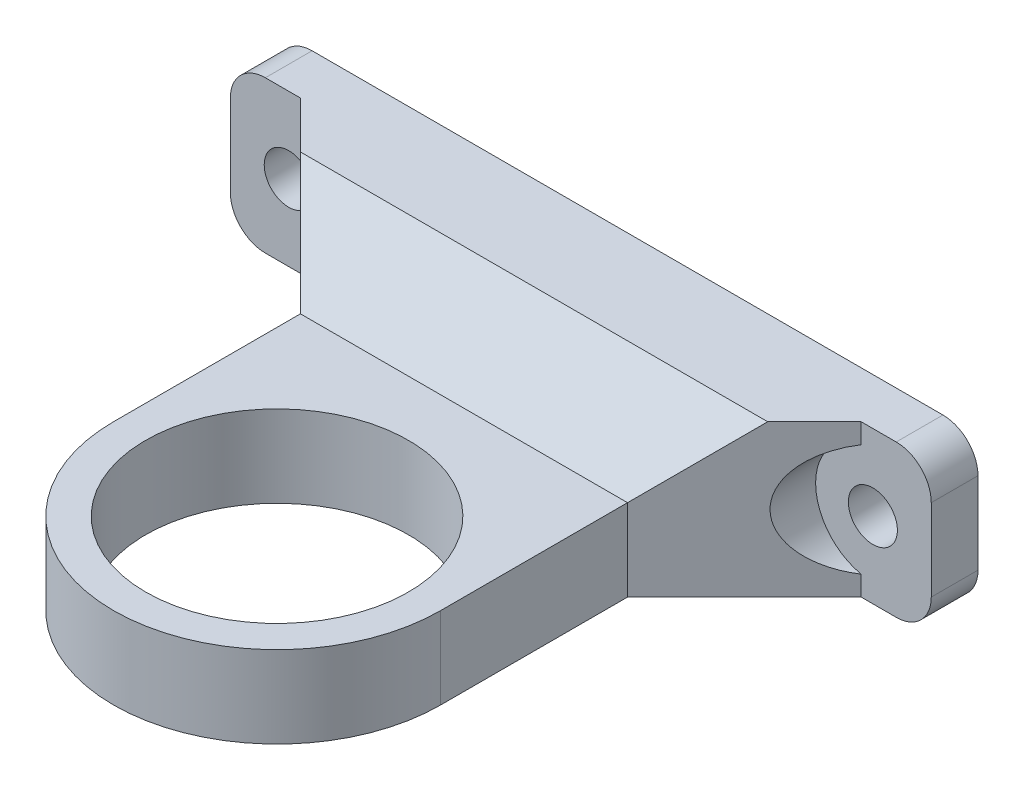
from build123d import *

# Parameters (mm, degrees)
ESBO_O1_R                = 14
ESBO_O1_R_2              = 11.25
RESSALTO_EXTRUS_O1_DEPTH = 3.5
ESBO_O2_W                = 60
ESBO_O2_H                = 4
RESSALTO_EXTRUS_O2_DEPTH = 6
CHANFRO3_SIZE            = 10
CHANFRO5_SIZE            = 10
ESBO_O6_R                = 2.1
CORTE_EXTRUS_O2_DEPTH    = 51.89449872
ESBO_O7_R                = 4.9
CORTE_EXTRUS_O6_DEPTH    = 51.89449872
FILETE1_R                = 3


with BuildPart() as part:
    # Esboço1 → Ressalto-extrusão1 (new, symmetric)
    # profile 1 of 3: a face of its own
    with BuildSketch(Plane(origin=(0, 0, 0), x_dir=(1, 0, 0), z_dir=(0, 1, 0))):
        Polygon((30, 22), (-30, 22), (-30, 18), (-14, 18), (14, 18), (30, 18), align=None)
    # profile 2 of 3: a face of its own
    with BuildSketch(Plane(origin=(0, 0, 0), x_dir=(1, 0, 0), z_dir=(0, 1, 0))):
        with BuildLine():
            Line((14, 18), (-14, 18))
            Line((-14, 18), (-14, -8))
            ThreePointArc((-14, -8), (0, 6), (14, -8))
            Line((14, -8), (14, 18))
        make_face()
    # profile 3 of 3: a face of its own
    with BuildSketch(Plane(origin=(0, 0, 0), x_dir=(1, 0, 0), z_dir=(0, 1, 0))):
        with Locations((0, -8)):
            Circle(ESBO_O1_R)
        with Locations(Location((0, -8, 0), (0, 0, 270))):
            Circle(ESBO_O1_R_2, mode=Mode.SUBTRACT)
    extrude(amount=RESSALTO_EXTRUS_O1_DEPTH, both=True)

    # Esboço2 → Ressalto-extrusão2 (add)
    with BuildSketch(Plane(origin=(0, 3.5, 0), x_dir=(1, 0, 0), z_dir=(0, 1, 0))):
        with Locations((0, 20)):
            Rectangle(ESBO_O2_W, ESBO_O2_H)
    extrude(amount=RESSALTO_EXTRUS_O2_DEPTH)

    # Chanfro3
    chanfro3_edges = [part.edges().sort_by_distance(p)[0] for p in [
        (14, 0, -18),
        (-14, 0, -18),
    ]]
    chamfer(chanfro3_edges, length=CHANFRO3_SIZE)

    # Chanfro5
    # the kernel refuses this chamfer: 10 mm, written as the material it adds along each edge
    with BuildSketch(Plane(origin=(-49.71682988, 3.5, -18), x_dir=(0, 0.9996219169112968, -0.027495876610586317), z_dir=(1, 0, 0))) as chanfro5_piece_1_section:
        Polygon((CHANFRO5_SIZE * 0.999621916911, CHANFRO5_SIZE * 0.0274958766106), (-CHANFRO5_SIZE * 0.0274958766106, CHANFRO5_SIZE * 0.999621916911), (0, 0), align=None)
    chanfro5_piece_1 = extrude(amount=99.433659759, mode=Mode.PRIVATE)
    chanfro5_piece_1 = split(chanfro5_piece_1, bisect_by=Plane(origin=(-17.624703453, 9.5, -15.249406907), z_dir=(0, -1, 0)), keep=Keep.TOP, mode=Mode.PRIVATE)
    chanfro5_piece_1 = split(chanfro5_piece_1, bisect_by=Plane(origin=(-19.43705518, 6.203831668, -13.43705518), z_dir=(0.7071067811865475, 0, -0.7071067811865477)), keep=Keep.TOP, mode=Mode.PRIVATE)
    chanfro5_piece_1 = split(chanfro5_piece_1, bisect_by=Plane(origin=(-14, 6.203831668, -15.249406907), z_dir=(-1, 0, 0)), keep=Keep.TOP, mode=Mode.PRIVATE)
    add(chanfro5_piece_1)
    with BuildSketch(Plane(origin=(-49.71682988, 3.5, -18), x_dir=(0, 0.9996219169112968, -0.027495876610586317), z_dir=(1, 0, 0))) as chanfro5_piece_2_section:
        Polygon((CHANFRO5_SIZE * 0.999621916911, CHANFRO5_SIZE * 0.0274958766106), (-CHANFRO5_SIZE * 0.0274958766106, CHANFRO5_SIZE * 0.999621916911), (0, 0), align=None)
    chanfro5_piece_2 = extrude(amount=99.433659759, mode=Mode.PRIVATE)
    chanfro5_piece_2 = split(chanfro5_piece_2, bisect_by=Plane(origin=(0, 9.5, -14.250020725), z_dir=(0, -1, 0)), keep=Keep.TOP, mode=Mode.PRIVATE)
    chanfro5_piece_2 = split(chanfro5_piece_2, bisect_by=Plane(origin=(10.125010362, 5.933615653, -4.125010362), z_dir=(-0.7071067811865479, 0, -0.7071067811865474)), keep=Keep.TOP, mode=Mode.PRIVATE)
    chanfro5_piece_2 = split(chanfro5_piece_2, bisect_by=Plane(origin=(14, 5.933615653, -14.250020725), z_dir=(-1, 0, 0)), keep=Keep.TOP, mode=Mode.PRIVATE)
    chanfro5_piece_2 = split(chanfro5_piece_2, bisect_by=Plane(origin=(-14, 5.933615653, -14.250020725), z_dir=(1, 0, 0)), keep=Keep.TOP, mode=Mode.PRIVATE)
    add(chanfro5_piece_2)
    with BuildSketch(Plane(origin=(-49.71682988, 3.5, -18), x_dir=(0, 0.9996219169112968, -0.027495876610586317), z_dir=(1, 0, 0))) as chanfro5_piece_3_section:
        Polygon((CHANFRO5_SIZE * 0.999621916911, CHANFRO5_SIZE * 0.0274958766106), (-CHANFRO5_SIZE * 0.0274958766106, CHANFRO5_SIZE * 0.999621916911), (0, 0), align=None)
    chanfro5_piece_3 = extrude(amount=99.433659759, mode=Mode.PRIVATE)
    chanfro5_piece_3 = split(chanfro5_piece_3, bisect_by=Plane(origin=(17.624703453, 9.5, -15.249406907), z_dir=(0, -1, 0)), keep=Keep.TOP, mode=Mode.PRIVATE)
    chanfro5_piece_3 = split(chanfro5_piece_3, bisect_by=Plane(origin=(19.43705518, 6.203831668, -13.43705518), z_dir=(-0.7071067811865479, 0, -0.7071067811865474)), keep=Keep.TOP, mode=Mode.PRIVATE)
    chanfro5_piece_3 = split(chanfro5_piece_3, bisect_by=Plane(origin=(14, 6.203831668, -15.249406907), z_dir=(1, 0, 0)), keep=Keep.TOP, mode=Mode.PRIVATE)
    add(chanfro5_piece_3)

    # Esboço6 → Corte-extrusão2 (cut, symmetric)
    with BuildSketch(Plane.XY.offset(-18)):
        with Locations((-25, 3)):
            Circle(ESBO_O6_R)
    corte_extrus_o2 = extrude(amount=CORTE_EXTRUS_O2_DEPTH, both=True, mode=Mode.SUBTRACT)

    # Esboço7 → Corte-extrusão6 (cut, through all)
    with BuildSketch(Plane.XY.offset(-18)):
        with Locations((-25, 3)):
            Circle(ESBO_O7_R)
    corte_extrus_o6 = extrude(amount=CORTE_EXTRUS_O6_DEPTH, mode=Mode.SUBTRACT)

    # Espelhar2: Corte-extrusão2, Corte-extrusão6 across plane
    add(corte_extrus_o2.mirror(Plane(origin=(0, 0, 0), x_dir=(0, 0, 1), z_dir=(1, 0, 0))), mode=Mode.SUBTRACT)
    add(corte_extrus_o6.mirror(Plane(origin=(0, 0, 0), x_dir=(0, 0, 1), z_dir=(1, 0, 0))), mode=Mode.SUBTRACT)

    # Filete1
    filete1_edges = [part.edges().sort_by_distance(p)[0] for p in [
        (30, -3.5, -20),
        (-30, -3.5, -20),
        (-30, 9.5, -20),
        (30, 9.5, -20),
    ]]
    fillet(filete1_edges, radius=FILETE1_R)


solid = part.part
